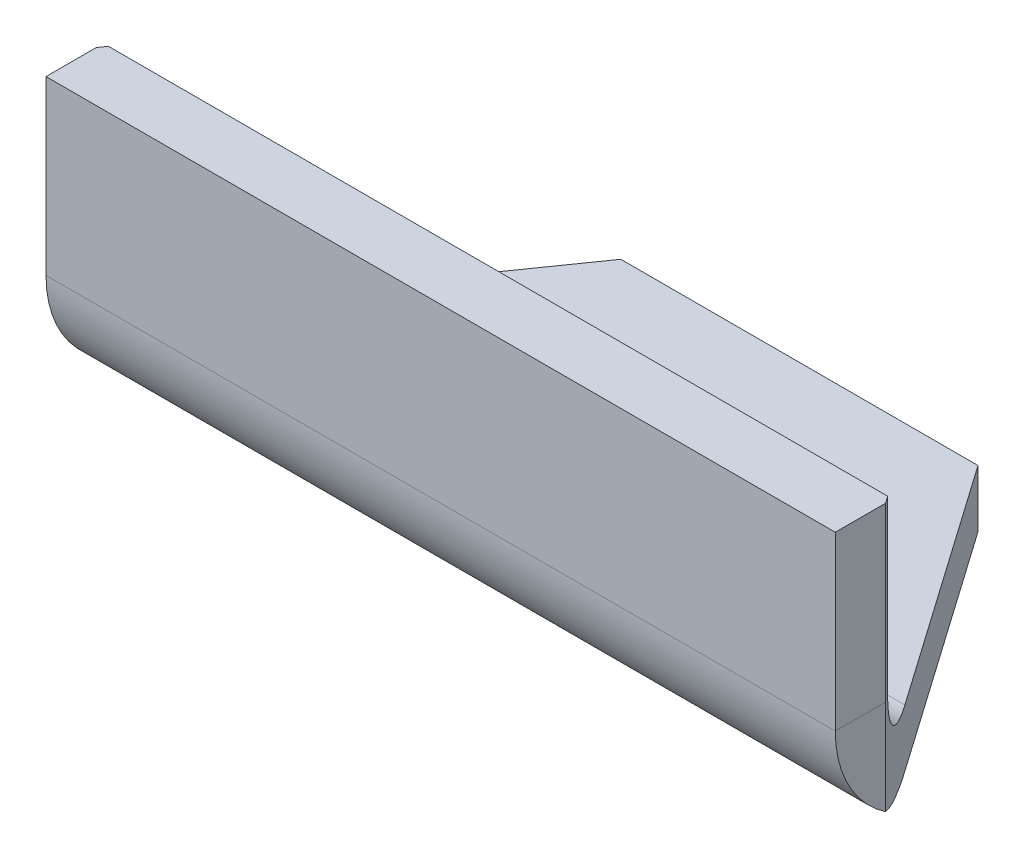
from build123d import *

# Parameters (mm, degrees)
SKETCH1_W                    = 110
SKETCH1_H                    = 50
BASE_FLANGE1_DEPTH           = 8
EDGE_FLANGE1_STRIP_W         = 48
EDGE_FLANGE1_STRIP_H         = 8
EDGE_FLANGE1_STRIP_CUT_DEPTH = 110
EDGE_FLANGE1_DEPTH           = 110
CHAMFER1_SIZE                = 43
CHAMFER1_SIZE2               = 30.108924143
MIRROR2_START                = 34.728986582
MIRROR2_OUTLINE_W            = 56
MIRROR2_OUTLINE_H            = 41
MIRROR2_DEPTH                = 24.663786763


# Read off the part's stored shape, not the designer's step: Mirror2
# Sheet-metal steps are written as plain solids
with BuildPart() as part:
    # Sketch1 → Base-Flange1 (new body)
    with BuildSketch(Plane(origin=(0, 0, 0), x_dir=(1, 0, 0), z_dir=(0, 1, 0))):
        Rectangle(SKETCH1_W, SKETCH1_H)
    extrude(amount=-BASE_FLANGE1_DEPTH)

    # Edge-Flange1 strip (across the edge) → Edge-Flange1 strip cut (cut)
    with BuildSketch(Plane(origin=(-55, 0, 25), x_dir=(0, 0, -1), z_dir=(1, 0, 0))):
        with Locations((-8, -4)):
            Rectangle(EDGE_FLANGE1_STRIP_W, EDGE_FLANGE1_STRIP_H)
    extrude(amount=EDGE_FLANGE1_STRIP_CUT_DEPTH, mode=Mode.SUBTRACT)

    # Edge-Flange1 section (across the edge) → Edge-Flange1 (add)
    with BuildSketch(Plane(origin=(-55, 0, 25), x_dir=(0, 0, -1), z_dir=(1, 0, 0))):
        with BuildLine():
            Line((0, 8), (0, 32))
            Line((0, 32), (8, 32))
            Line((8, 32), (8, 8))
            ThreePointArc((8, 8), (10.343145751, 2.343145751), (16, 0))
            Line((16, 0), (16, -8))
            ThreePointArc((16, -8), (4.686291501, -3.313708499), (0, 8))
        make_face()
    extrude(amount=EDGE_FLANGE1_DEPTH)

    # Chamfer1
    chamfer1_edges = [part.edges().sort_by_distance(p)[0] for p in [
        (-55, -4, -25),
    ]]
    chamfer1_side = [part.faces().sort_by_distance(p)[0] for p in [
        (-55, -0.640312424, -8),
    ]]
    chamfer(chamfer1_edges, length=CHAMFER1_SIZE, length2=CHAMFER1_SIZE2, reference=chamfer1_side[0])

    # Mirror2 outline → Mirror2 (cut)
    with BuildSketch(Plane(origin=(0, 0, 0), x_dir=(0.5735764363510512, 0, 0.8191520442889882), z_dir=(0.8191520442889882, 0, -0.5735764363510512)).offset(MIRROR2_START)):
        with Locations((20, -12.5)):
            Rectangle(MIRROR2_OUTLINE_W, MIRROR2_OUTLINE_H)
    extrude(amount=MIRROR2_DEPTH, mode=Mode.SUBTRACT)


solid = part.part
